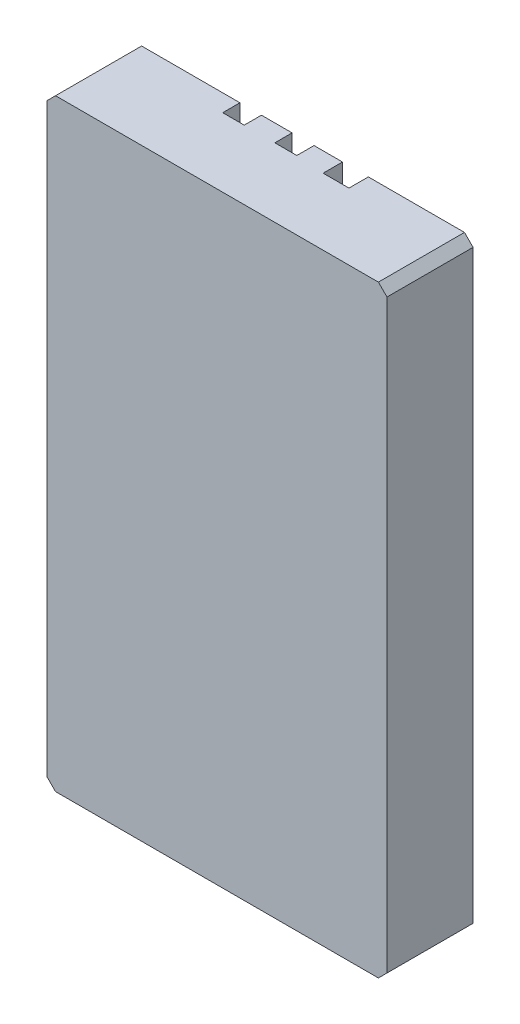
from build123d import *

# Parameters (mm, degrees)
SKETCH1_W           = 79
SKETCH1_H           = 140
BOSS_EXTRUDE1_DEPTH = 20
SKETCH3_W           = 5
SKETCH3_H           = 5
CUT_EXTRUDE1_DEPTH  = 131
SKETCH4_W           = 11
SKETCH4_H           = 25
CUT_EXTRUDE2_DEPTH  = 4
FILLET1_R           = 2
CHAMFER1_SIZE       = 0.5
SKETCH6_W           = 5.105326573
SKETCH6_H           = 5
CUT_EXTRUDE3_DEPTH  = 100
SKETCH7_W           = 10.105326573
SKETCH7_H           = 25
CUT_EXTRUDE4_DEPTH  = 4
FILLET2_R           = 2
CHAMFER2_SIZE       = 0.5
SKETCH8_W           = 6
SKETCH8_H           = 6
CUT_EXTRUDE5_DEPTH  = 103
SKETCH9_W           = 11
SKETCH9_H           = 25
CUT_EXTRUDE6_DEPTH  = 4.5
FILLET3_R           = 2
CHAMFER3_SIZE       = 2


with BuildPart() as part:
    # Sketch1 → Boss-Extrude1 (new body)
    with BuildSketch(Plane.XY):
        with Locations((-21, -129)):
            Rectangle(SKETCH1_W, SKETCH1_H)
    extrude(amount=-BOSS_EXTRUDE1_DEPTH)

    # Sketch3 → Cut-Extrude1 (cut)
    with BuildSketch(Plane(origin=(0, -59, 0), x_dir=(1, 0, 0), z_dir=(0, 1, 0))):
        with Locations((-33.165, 18.5)):
            Rectangle(SKETCH3_W, SKETCH3_H)
    extrude(amount=-CUT_EXTRUDE1_DEPTH, mode=Mode.SUBTRACT)

    # Sketch4 → Cut-Extrude2 (cut)
    with BuildSketch(Plane(origin=(0, 0, -20), x_dir=(-1, 0, 0), z_dir=(0, 0, -1))):
        with Locations((33.165, -177.5)):
            Rectangle(SKETCH4_W, SKETCH4_H)
    extrude(amount=-CUT_EXTRUDE2_DEPTH, mode=Mode.SUBTRACT)

    # Fillet1
    fillet1_edges = [part.edges().sort_by_distance(p)[0] for p in [
        (-38.665, -190, -18),
        (-27.665, -165, -18),
        (-38.665, -165, -18),
        (-27.665, -190, -18),
    ]]
    fillet(fillet1_edges, radius=FILLET1_R)

    # Chamfer1
    chamfer1_edges = [part.edges().sort_by_distance(p)[0] for p in [
        (-30.665, -165, -18),
        (-35.665, -165, -18),
    ]]
    chamfer(chamfer1_edges, length=CHAMFER1_SIZE)

    # Sketch6 → Cut-Extrude3 (cut)
    with BuildSketch(Plane(origin=(0, -59, 0), x_dir=(1, 0, 0), z_dir=(0, 1, 0))):
        with Locations((-20.998333333, 18.5)):
            Rectangle(SKETCH6_W, SKETCH6_H)
    extrude(amount=-CUT_EXTRUDE3_DEPTH, mode=Mode.SUBTRACT)

    # Sketch7 → Cut-Extrude4 (cut)
    with BuildSketch(Plane(origin=(0, 0, -20), x_dir=(-1, 0, 0), z_dir=(0, 0, -1))):
        with Locations((20.998333333, -146.5)):
            Rectangle(SKETCH7_W, SKETCH7_H)
    extrude(amount=-CUT_EXTRUDE4_DEPTH, mode=Mode.SUBTRACT)

    # Fillet2
    fillet2_edges = [part.edges().sort_by_distance(p)[0] for p in [
        (-26.05099662, -159, -18),
        (-15.945670047, -134, -18),
        (-26.05099662, -134, -18),
        (-15.945670047, -159, -18),
    ]]
    fillet(fillet2_edges, radius=FILLET2_R)

    # Chamfer2
    chamfer2_edges = [part.edges().sort_by_distance(p)[0] for p in [
        (-23.55099662, -134, -18),
        (-18.445670047, -134, -18),
    ]]
    chamfer(chamfer2_edges, length=CHAMFER2_SIZE - 0.0001)  # a hair under: the kernel refuses the full size

    # Sketch8 → Cut-Extrude5 (cut)
    with BuildSketch(Plane(origin=(0, -59, 0), x_dir=(1, 0, 0), z_dir=(0, 1, 0))):
        with Locations((-8.833333333, 18.5)):
            Rectangle(SKETCH8_W, SKETCH8_H)
    extrude(amount=-CUT_EXTRUDE5_DEPTH, mode=Mode.SUBTRACT)

    # Sketch9 → Cut-Extrude6 (cut)
    with BuildSketch(Plane(origin=(0, 0, -20), x_dir=(-1, 0, 0), z_dir=(0, 0, -1))):
        with Locations((8.833333333, -149.5)):
            Rectangle(SKETCH9_W, SKETCH9_H)
    extrude(amount=-CUT_EXTRUDE6_DEPTH, mode=Mode.SUBTRACT)

    # Fillet3
    fillet3_edges = [part.edges().sort_by_distance(p)[0] for p in [
        (-14.333333333, -162, -17.75),
        (-3.333333333, -137, -17.75),
        (-14.333333333, -137, -17.75),
        (-3.333333333, -162, -17.75),
    ]]
    fillet(fillet3_edges, radius=FILLET3_R)

    # Chamfer3
    chamfer3_edges = [part.edges().sort_by_distance(p)[0] for p in [
        (-60.5, -59, -10),
        (18.5, -59, -10),
        (18.5, -199, -10),
        (-60.5, -199, -10),
    ]]
    chamfer(chamfer3_edges, length=CHAMFER3_SIZE)


solid = part.part
